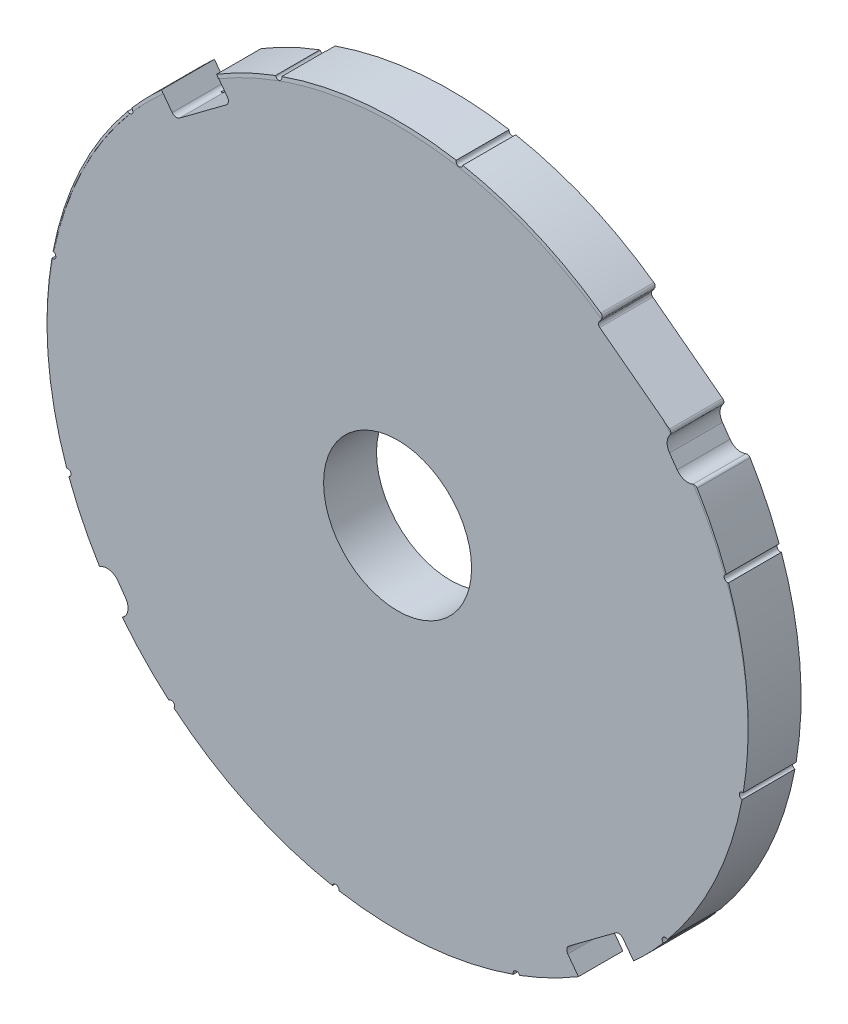
from build123d import *

# Parameters (mm, degrees)
BASE_EXTRUDE_DEPTH = 20
CAVITY1_START      = 11.7585082
CAVITY1_DEPTH      = 8.2414918
CAVITY1_START_2    = -1
CAVITY1_2_DEPTH    = 15.697061054
CAVITY1_3_DEPTH    = 2.29
SKETCH2_R          = 11.18659516645681
CUT_EXTRUDE1_DEPTH = 91.58678080447103
CUT_REVOLVE1_ANGLE = 23.000000000000057
CIRPATTERN1_COUNT  = 2
CUT_EXTRUDE3_DEPTH = 90.13039535596234
CUT_EXTRUDE4_DEPTH = 90.13039535596234
FILLET4_R          = 0.5


with BuildPart() as part:
    # Sketch1 → Base-Extrude (new body)
    with BuildSketch(Plane.XY):
        with BuildLine():
            ThreePointArc((11.448944702651374, -52.08824831144696), (69.92229086463853, -5.196161680327596), (23.030204233519367, 53.277184481659724))
            ThreePointArc((23.030204233519367, 53.277184481659724), (-32.14929663197637, 19.823077277180207), (-14.116616210967551, -42.13478777196285))
            ThreePointArc((-14.116616210967551, -42.13478777196285), (-1.9890347239884356, -48.79440301495523), (11.448944702651374, -52.08824831144696))
        make_face()
    extrude(amount=BASE_EXTRUDE_DEPTH)

    # Cavity1: read off the stored shape, not the designer's step
    # Cavity1 outline → Cavity1 (cut)
    with BuildSketch(Plane.XY.offset(CAVITY1_START)):
        with BuildLine():
            ThreePointArc((51.04805128, 41.410970822), (51.109037556, 40.708174846), (51.812113385, 40.765845369))
            ThreePointArc((51.812113385, 40.765845369), (51.431603871, 41.090210148), (51.04805128, 41.410970822))
        make_face()
        with BuildLine():
            ThreePointArc((62.283261236, 28.524134792), (60.630119115, 31.028998395), (58.83784271, 33.436271922))
            ThreePointArc((58.83784271, 33.436271922), (58.016420793, 32.144601769), (58.348936509, 30.650420036))
            Line((58.348936509, 30.650420036), (59.497409351, 29.013040993))
            ThreePointArc((59.497409351, 29.013040993), (60.789079504, 28.191619076), (62.283261236, 28.524134792))
        make_face()
        with BuildLine():
            ThreePointArc((26.110322882, 52.846834755), (26.514536534, 52.268688724), (27.094582801, 52.670170776))
            ThreePointArc((27.094582801, 52.670170776), (26.602869506, 52.760824159), (26.110322882, 52.846834755))
        make_face()
        with BuildLine():
            ThreePointArc((67.265960085, 18.09763186), (67.09861157, 18.568794756), (66.926825619, 19.038357943))
            ThreePointArc((66.926825619, 19.038357943), (66.628243296, 18.399225636), (67.265960085, 18.09763186))
        make_face()
        with BuildLine():
            ThreePointArc((-1.20431539, 50.281719236), (-0.565183083, 49.983136913), (-0.263589306, 50.620853702))
            ThreePointArc((-0.263589306, 50.620853702), (-0.734752202, 50.453505187), (-1.20431539, 50.281719236))
        make_face()
        with BuildLine():
            Line((-8.492819574, 43.830040678), (-10.106102114, 45.99506249))
            ThreePointArc((-10.106102114, 45.99506249), (-14.428564281, 43.093044393), (-18.445445389, 39.78093715))
            Line((-18.445445389, 39.78093715), (-16.832162849, 37.615915338))
            ThreePointArc((-16.832162849, 37.615915338), (-16.306271521, 37.302320645), (-15.712665263, 37.452437035))
            Line((-15.712665263, 37.452437035), (-8.656297877, 42.710543092))
            ThreePointArc((-8.656297877, 42.710543092), (-8.342703184, 43.23643442), (-8.492819574, 43.830040678))
        make_face()
        with BuildLine():
            ThreePointArc((69.315277159, -9.260540248), (69.405930542, -8.768826953), (69.491941138, -8.276280329))
            ThreePointArc((69.491941138, -8.276280329), (68.913795107, -8.680493981), (69.315277159, -9.260540248))
        make_face()
        with BuildLine():
            ThreePointArc((-23.576928269, 34.402944897), (-22.874132293, 34.463931173), (-22.931802816, 35.167007002))
            ThreePointArc((-22.931802816, 35.167007002), (-23.256167595, 34.786497488), (-23.576928269, 34.402944897))
        make_face()
        with BuildLine():
            ThreePointArc((57.410951752, -33.978070831), (57.735316532, -33.597561318), (58.056077205, -33.214008727))
            ThreePointArc((58.056077205, -33.214008727), (57.353281229, -33.274995003), (57.410951752, -33.978070831))
        make_face()
        with BuildLine():
            ThreePointArc((-35.012792202, 9.465216499), (-34.434646171, 9.869430151), (-34.836128223, 10.449476418))
            ThreePointArc((-34.836128223, 10.449476418), (-34.926781606, 9.957763123), (-35.012792202, 9.465216499))
        make_face()
        with BuildLine():
            ThreePointArc((44.58525105, -44.806126319), (48.907713217, -41.904108222), (52.924594325, -38.59200098))
            Line((52.924594325, -38.59200098), (51.311311785, -36.426979168))
            ThreePointArc((51.311311785, -36.426979168), (50.785420458, -36.113384475), (50.1918142, -36.263500865))
            Line((50.1918142, -36.263500865), (43.135446813, -41.521606922))
            ThreePointArc((43.135446813, -41.521606922), (42.82185212, -42.047498249), (42.97196851, -42.641104507))
            Line((42.97196851, -42.641104507), (44.58525105, -44.806126319))
        make_face()
        with BuildLine():
            ThreePointArc((-32.447676683, -17.849421773), (-32.149094359, -17.210289466), (-32.786811149, -16.908695689))
            ThreePointArc((-32.786811149, -16.908695689), (-32.619462634, -17.379858585), (-32.447676683, -17.849421773))
        make_face()
        with BuildLine():
            ThreePointArc((34.742738243, -49.431917532), (35.213901139, -49.264569017), (35.683464326, -49.092783066))
            ThreePointArc((35.683464326, -49.092783066), (35.044332019, -48.794200742), (34.742738243, -49.431917532))
        make_face()
        with BuildLine():
            ThreePointArc((-25.018260415, -27.824104823), (-26.309930568, -27.002682905), (-27.8041123, -27.335198621))
            ThreePointArc((-27.8041123, -27.335198621), (-26.15097018, -29.840062225), (-24.358693774, -32.247335751))
            ThreePointArc((-24.358693774, -32.247335751), (-23.537271857, -30.955665598), (-23.869787573, -29.461483866))
            Line((-23.869787573, -29.461483866), (-25.018260415, -27.824104823))
        make_face()
        with BuildLine():
            ThreePointArc((7.384566135, -51.481234606), (7.87627943, -51.571887989), (8.368826054, -51.657898585))
            ThreePointArc((8.368826054, -51.657898585), (7.964612402, -51.079752554), (7.384566135, -51.481234606))
        make_face()
        with BuildLine():
            ThreePointArc((-16.568902344, -40.222034652), (-16.62988862, -39.519238676), (-17.332964448, -39.576909199))
            ThreePointArc((-17.332964448, -39.576909199), (-16.952454935, -39.901273979), (-16.568902344, -40.222034652))
        make_face()
    extrude(amount=CAVITY1_DEPTH, mode=Mode.SUBTRACT)

    # Cavity1 2 outline → Cavity1 2 (cut)
    with BuildSketch(Plane.XY.offset(CAVITY1_START_2)):
        with BuildLine():
            ThreePointArc((51.04805128, 41.410970822), (51.109037556, 40.708174846), (51.812113385, 40.765845369))
            ThreePointArc((51.812113385, 40.765845369), (51.431603871, 41.090210148), (51.04805128, 41.410970822))
        make_face()
        with BuildLine():
            ThreePointArc((62.283261236, 28.524134792), (60.630119115, 31.028998395), (58.83784271, 33.436271922))
            ThreePointArc((58.83784271, 33.436271922), (58.016420793, 32.144601769), (58.348936509, 30.650420036))
            Line((58.348936509, 30.650420036), (59.497409351, 29.013040993))
            ThreePointArc((59.497409351, 29.013040993), (60.789079504, 28.191619076), (62.283261236, 28.524134792))
        make_face()
        with BuildLine():
            ThreePointArc((26.110322882, 52.846834755), (26.514536534, 52.268688724), (27.094582801, 52.670170776))
            ThreePointArc((27.094582801, 52.670170776), (26.602869506, 52.760824159), (26.110322882, 52.846834755))
        make_face()
        with BuildLine():
            ThreePointArc((67.265960085, 18.09763186), (67.09861157, 18.568794756), (66.926825619, 19.038357943))
            ThreePointArc((66.926825619, 19.038357943), (66.628243296, 18.399225636), (67.265960085, 18.09763186))
        make_face()
        with BuildLine():
            ThreePointArc((-1.20431539, 50.281719236), (-0.565183083, 49.983136913), (-0.263589306, 50.620853702))
            ThreePointArc((-0.263589306, 50.620853702), (-0.734752202, 50.453505187), (-1.20431539, 50.281719236))
        make_face()
        with BuildLine():
            ThreePointArc((69.315277159, -9.260540248), (69.405930542, -8.768826953), (69.491941138, -8.276280329))
            ThreePointArc((69.491941138, -8.276280329), (68.913795107, -8.680493981), (69.315277159, -9.260540248))
        make_face()
        with BuildLine():
            ThreePointArc((-23.576928269, 34.402944897), (-22.874132293, 34.463931173), (-22.931802816, 35.167007002))
            ThreePointArc((-22.931802816, 35.167007002), (-23.256167595, 34.786497488), (-23.576928269, 34.402944897))
        make_face()
        with BuildLine():
            ThreePointArc((57.410951752, -33.978070831), (57.735316532, -33.597561318), (58.056077205, -33.214008727))
            ThreePointArc((58.056077205, -33.214008727), (57.353281229, -33.274995003), (57.410951752, -33.978070831))
        make_face()
        with BuildLine():
            ThreePointArc((-35.012792202, 9.465216499), (-34.434646171, 9.869430151), (-34.836128223, 10.449476418))
            ThreePointArc((-34.836128223, 10.449476418), (-34.926781606, 9.957763123), (-35.012792202, 9.465216499))
        make_face()
        with BuildLine():
            ThreePointArc((-32.447676683, -17.849421773), (-32.149094359, -17.210289466), (-32.786811149, -16.908695689))
            ThreePointArc((-32.786811149, -16.908695689), (-32.619462634, -17.379858585), (-32.447676683, -17.849421773))
        make_face()
        with BuildLine():
            ThreePointArc((34.742738243, -49.431917532), (35.213901139, -49.264569017), (35.683464326, -49.092783066))
            ThreePointArc((35.683464326, -49.092783066), (35.044332019, -48.794200742), (34.742738243, -49.431917532))
        make_face()
        with BuildLine():
            ThreePointArc((-25.018260415, -27.824104823), (-26.309930568, -27.002682905), (-27.8041123, -27.335198621))
            ThreePointArc((-27.8041123, -27.335198621), (-26.15097018, -29.840062225), (-24.358693774, -32.247335751))
            ThreePointArc((-24.358693774, -32.247335751), (-23.537271857, -30.955665598), (-23.869787573, -29.461483866))
            Line((-23.869787573, -29.461483866), (-25.018260415, -27.824104823))
        make_face()
        with BuildLine():
            ThreePointArc((7.384566135, -51.481234606), (7.87627943, -51.571887989), (8.368826054, -51.657898585))
            ThreePointArc((8.368826054, -51.657898585), (7.964612402, -51.079752554), (7.384566135, -51.481234606))
        make_face()
        with BuildLine():
            ThreePointArc((-16.568902344, -40.222034652), (-16.62988862, -39.519238676), (-17.332964448, -39.576909199))
            ThreePointArc((-17.332964448, -39.576909199), (-16.952454935, -39.901273979), (-16.568902344, -40.222034652))
        make_face()
    extrude(amount=CAVITY1_2_DEPTH, mode=Mode.SUBTRACT)

    # Cavity1 3 outline → Cavity1 3 (cut)
    with BuildSketch(Plane.XY.offset(CAVITY1_START_2)):
        with BuildLine():
            Line((-8.492819574, 43.830040678), (-10.106102114, 45.99506249))
            ThreePointArc((-10.106102114, 45.99506249), (-14.428564281, 43.093044393), (-18.445445389, 39.78093715))
            Line((-18.445445389, 39.78093715), (-16.832162849, 37.615915338))
            ThreePointArc((-16.832162849, 37.615915338), (-16.306271521, 37.302320645), (-15.712665263, 37.452437035))
            Line((-15.712665263, 37.452437035), (-8.656297877, 42.710543092))
            ThreePointArc((-8.656297877, 42.710543092), (-8.342703184, 43.23643442), (-8.492819574, 43.830040678))
        make_face()
        with BuildLine():
            ThreePointArc((44.58525105, -44.806126319), (48.907713217, -41.904108222), (52.924594325, -38.59200098))
            Line((52.924594325, -38.59200098), (51.311311785, -36.426979168))
            ThreePointArc((51.311311785, -36.426979168), (50.785420458, -36.113384475), (50.1918142, -36.263500865))
            Line((50.1918142, -36.263500865), (43.135446813, -41.521606922))
            ThreePointArc((43.135446813, -41.521606922), (42.82185212, -42.047498249), (42.97196851, -42.641104507))
            Line((42.97196851, -42.641104507), (44.58525105, -44.806126319))
        make_face()
    extrude(amount=CAVITY1_3_DEPTH, mode=Mode.SUBTRACT)

    # Cavity1 4 outline → Cavity1 4 (revolve, cut)
    with BuildSketch(Plane(origin=(17.239574468, 0.594468085, 0), x_dir=(1, 0, 0), z_dir=(0, -1, 0))):
        with BuildLine():
            ThreePointArc((8.455581997, 14.697061154), (9.257673833, 12.704161987), (11.186595166, 11.7585083))
            Line((11.186595166, 11.7585083), (53.000000004, 8))
            Line((53.000000004, 8), (53.000000004, 11.7585082))
            Line((53.000000004, 11.7585082), (53.000000004, 20))
            Line((53.000000004, 20), (8.368247694, 20))
            Line((8.368247694, 20), (8.455581997, 14.697061154))
        make_face()
    revolve(axis=Axis((17.239574468, 0.594468085, 0), (0, 0, 1)), mode=Mode.SUBTRACT)

    # Sketch2 → Cut-Extrude1 (cut, through all)
    with BuildSketch(Plane(origin=(0, 0, 0), x_dir=(-1, 0, 0), z_dir=(0, 0, -1))):
        with Locations((-17.239574468085188, 0.5944680851063974)):
            Circle(SKETCH2_R)
    extrude(amount=-CUT_EXTRUDE1_DEPTH, mode=Mode.SUBTRACT)

    # Sketch3 → Cut-Revolve1 (revolve, cut)
    with BuildSketch(Plane(origin=(9.720192589070944, 8.851659101599466, 4.77e-15), x_dir=(-1.5e-16, -1.4e-16, -1), z_dir=(0.7393673408483635, 0.6733022614597547, 0))):
        Polygon((-1.2899999999999845, 38.27048183461742), (4.68e-15, 38.27048183461742), (4.82e-15, 39.145112608811395), (4.77e-15, 41.83208581133874), (-1.2899999999999834, 41.83208581133874), (-1.2899999999999843, 39.1451126088114), align=None)
    cut_revolve1 = revolve(axis=Axis((17.415751153762294, 0.4010047699434006, -29.674218098591606), (-1.5e-16, -1.5e-16, -1)), revolution_arc=CUT_REVOLVE1_ANGLE, mode=Mode.SUBTRACT)

    # CirPattern1: Cut-Revolve1 ×2 about axis
    cirpattern1_axis = Axis((17.23957446808522, 0.5944680851064198, 0), (0, 0, 1))
    for i in range(1, CIRPATTERN1_COUNT):
        add(cut_revolve1.rotate(cirpattern1_axis, i * 360 / CIRPATTERN1_COUNT), mode=Mode.SUBTRACT)

    # Sketch5 → Cut-Extrude3 (cut, through all)
    with BuildSketch(Plane(origin=(0, 0, 0), x_dir=(-1, 0, 0), z_dir=(0, 0, -1))):
        with BuildLine():
            Line((16.83216284922741, 37.61591533818054), (18.445445389281943, 39.780937150069555))
            ThreePointArc((18.445445389281943, 39.780937150069555), (14.428564281133532, 43.09304439255737), (10.10610211385761, 45.99506248953888))
            Line((10.10610211385761, 45.99506248953888), (8.492819573803073, 43.830040677649876))
            ThreePointArc((8.492819573803073, 43.830040677649876), (8.34270318365288, 43.236434419689694), (8.656297876568848, 42.71054309188883))
            Line((8.656297876568848, 42.71054309188883), (15.712665263466361, 37.452437035414775))
            ThreePointArc((15.712665263466361, 37.452437035414775), (16.30627152142654, 37.30232064526458), (16.83216284922741, 37.61591533818054))
        make_face()
        with BuildLine():
            Line((-43.13544681273893, -41.52160692167621), (-50.19181419963648, -36.263500865202204))
            ThreePointArc((-50.19181419963648, -36.263500865202204), (-50.78542045759667, -36.11338447505201), (-51.311311785397535, -36.42697916796798))
            Line((-51.311311785397535, -36.42697916796798), (-52.92459432545205, -38.59200097985699))
            ThreePointArc((-52.92459432545205, -38.59200097985699), (-48.907713217303616, -41.904108222344775), (-44.58525105002767, -44.80612631932627))
            Line((-44.58525105002767, -44.80612631932627), (-42.971968509973145, -42.64110450743725))
            ThreePointArc((-42.971968509973145, -42.64110450743725), (-42.821852119822964, -42.04749824947707), (-43.13544681273893, -41.52160692167621))
        make_face()
    extrude(amount=-CUT_EXTRUDE3_DEPTH, mode=Mode.SUBTRACT)

    # Sketch6 → Cut-Extrude4 (cut, through all)
    with BuildSketch(Plane(origin=(0, 0, 0), x_dir=(-1, 0, 0), z_dir=(0, 0, -1))):
        with BuildLine():
            Line((-58.837842710523745, 33.43627192153001), (-47.43649933895138, 42.06757363816018))
            Line((-47.43649933895138, 42.06757363816018), (-48.37213146987308, 43.486937057298114))
            ThreePointArc((-48.37213146987308, 43.486937057298114), (-50.120282982373844, 42.16199155714388), (-51.812113384568406, 40.76584536879253))
            ThreePointArc((-51.812113384568406, 40.76584536879253), (-55.50089472157509, 37.269682773774335), (-58.837842710523745, 33.43627192153001))
        make_face()
    extrude(amount=-CUT_EXTRUDE4_DEPTH, mode=Mode.SUBTRACT)

    # Fillet4
    fillet4_edges = [part.edges().sort_by_distance(p)[0] for p in [
        (62.28326123598663, 28.524134791991596, 4),
        (48.37213146987308, 43.48693705729811, 4),
        (47.43649933895138, 42.06757363816018, 4.076324439930612),
        (58.83784271003765, 33.43627192202967, 4),
    ]]
    fillet(fillet4_edges, radius=FILLET4_R)

    # Sketch7 → Cut-Revolve2 (revolve, cut)
    with BuildSketch(Plane(origin=(0, 0, 0), x_dir=(1, 0, 0), z_dir=(0, 1, 0))):
        Polygon((-35.76042553191482, -7.999999999999983), (-34.926781605752716, -15.145628683507939), (17.239574468085184, -17.822276480638916), (17.23957446808518, -7.9999999999999964), align=None)
    revolve(axis=Axis((17.239574468085184, 0, -23.96916738601238), (0, 0, 1)), mode=Mode.SUBTRACT)


solid = part.part
